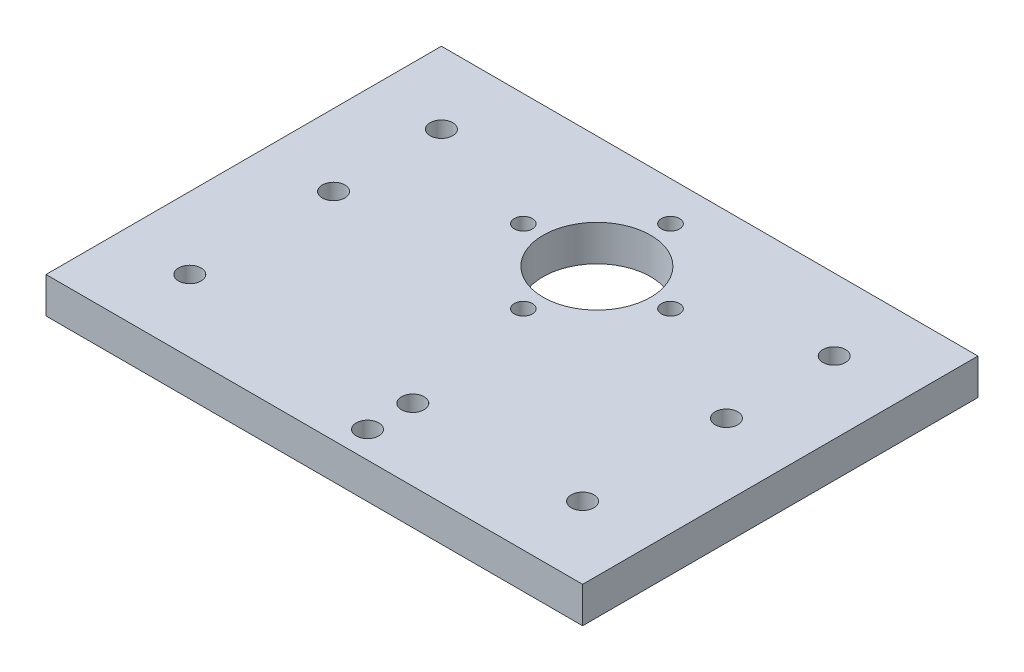
from build123d import *

# Parameters (mm, degrees)
SKETCH1_W                                       = 94.8
SKETCH1_H                                       = 69.85
SKETCH1_R                                       = 2
SKETCH1_R_2                                     = 9.5
BOSS_EXTRUDE1_DEPTH                             = 6.35
CSK_FOR_M3_FLAT_HEAD_MACHINE_SCREW1_D           = 3.2
CSK_FOR_M3_FLAT_HEAD_MACHINE_SCREW1_CSINK_D     = 6.3
CSK_FOR_M3_FLAT_HEAD_MACHINE_SCREW1_CSINK_ANGLE = 90


with BuildPart() as part:
    # Sketch1 → Boss-Extrude1 (new body)
    with BuildSketch(Plane(origin=(0, 0, 0), x_dir=(1, 0, 0), z_dir=(0, 1, 0))):
        Rectangle(SKETCH1_W, SKETCH1_H)
        with Locations((-34.7, 22.225)):
            Circle(SKETCH1_R, mode=Mode.SUBTRACT)
        with Locations((34.7, 22.225)):
            Circle(SKETCH1_R, mode=Mode.SUBTRACT)
        with Locations((34.7, -22.225)):
            Circle(SKETCH1_R, mode=Mode.SUBTRACT)
        with Locations((-34.7, -22.225)):
            Circle(SKETCH1_R, mode=Mode.SUBTRACT)
        with Locations((4.7, -30.225)):
            Circle(SKETCH1_R, mode=Mode.SUBTRACT)
        with Locations((4.7, -22.225)):
            Circle(SKETCH1_R, mode=Mode.SUBTRACT)
        with Locations((0, 15)):
            Circle(SKETCH1_R_2, mode=Mode.SUBTRACT)
        with Locations((-34.7, 3.175)):
            Circle(SKETCH1_R, mode=Mode.SUBTRACT)
        with Locations((34.7, 3.175)):
            Circle(SKETCH1_R, mode=Mode.SUBTRACT)
    extrude(amount=BOSS_EXTRUDE1_DEPTH)

    # CSK for M3 Flat Head Machine Screw1 (through all)
    with Locations(Plane(origin=(0, 0, 0), x_dir=(-1, 0, 0), z_dir=(0, -1, 0))):
        with Locations((-13, 15), (0, 2), (13, 15), (0, 28)):
            CounterSinkHole(CSK_FOR_M3_FLAT_HEAD_MACHINE_SCREW1_D / 2, CSK_FOR_M3_FLAT_HEAD_MACHINE_SCREW1_CSINK_D / 2, counter_sink_angle=CSK_FOR_M3_FLAT_HEAD_MACHINE_SCREW1_CSINK_ANGLE)


solid = part.part
